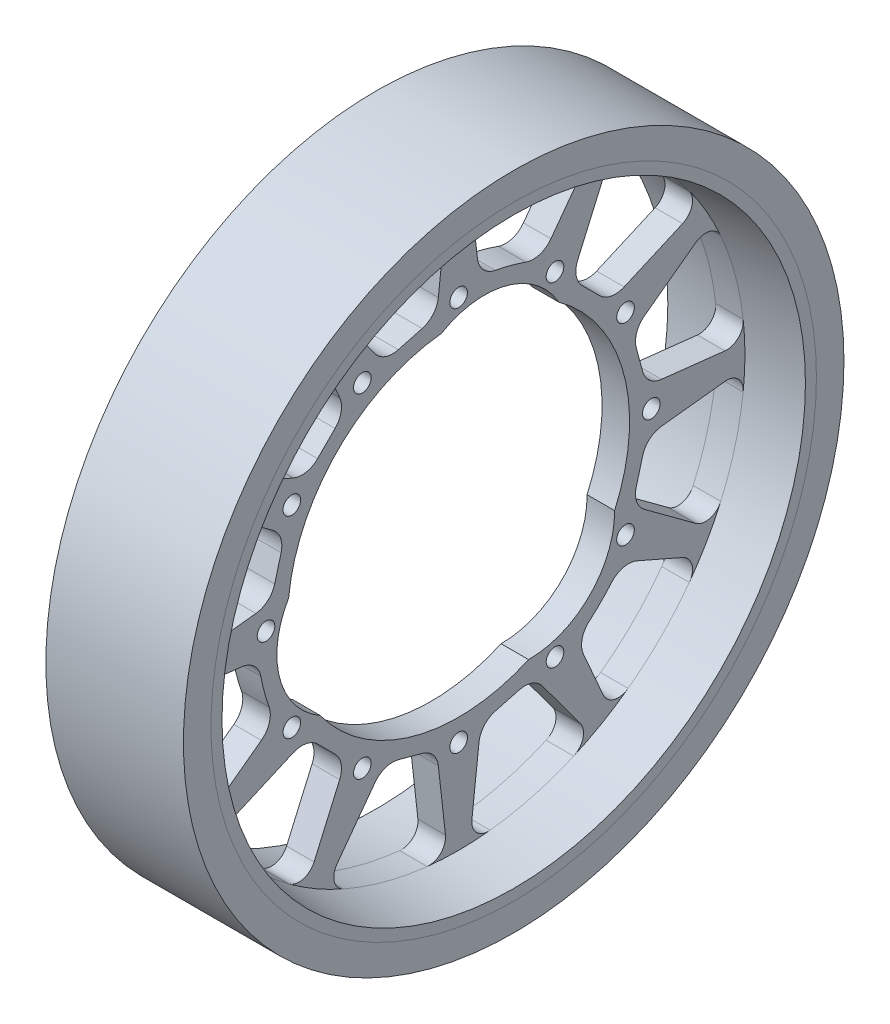
from build123d import *

# Parameters (mm, degrees)
SKETCH_2_R               = 1.6
CUT_EXTRUDE_1_DEPTH      = 80.214897589
SKETCH_3_W               = 25
SKETCH_3_H               = 5
CUT_EXTRUDE_2_DEPTH      = 87.168439698
PATTERN_CIRCULAR_1_COUNT = 12
SKETCH_5_R               = 15.5
CUT_EXTRUDE_3_DEPTH      = 10
EXTRUDE_1_DEPTH          = 5
PATTERN_CIRCULAR_6_COUNT = 3
FILLET_1_R               = 4


with BuildPart() as part:
    # 草图1 → 旋转1 (revolve)
    with BuildSketch(Plane.XY, mode=Mode.PRIVATE) as revolve_1_sk:
        Polygon((-12.5, 55), (-12.5, 53), (-2.5, 52), (-2.5, 31.05), (2.5, 31.05), (2.5, 52), (12.5, 53), (12.5, 55), align=None)
    revolve(revolve_1_sk.sketch.rotate(Axis((0, 0, 0), (-1, 0, 0)), 90), axis=Axis((0, 0, 0), (-1, 0, 0)))

    # 草图2 → 切除-拉伸1 (cut, through all)
    with BuildSketch(Plane(origin=(2.5, 0, 0), x_dir=(0, 0, -1), z_dir=(1, 0, 0))):
        with Locations((0, 35)):
            Circle(SKETCH_2_R)
        with Locations((17.5, 30.310889132)):
            Circle(SKETCH_2_R)
        with Locations((30.310889132, 17.5)):
            Circle(SKETCH_2_R)
        with Locations((35, 0)):
            Circle(SKETCH_2_R)
        with Locations((30.310889132, -17.5)):
            Circle(SKETCH_2_R)
        with Locations((17.5, -30.310889132)):
            Circle(SKETCH_2_R)
        with Locations((0, -35)):
            Circle(SKETCH_2_R)
        with Locations((-17.5, -30.310889132)):
            Circle(SKETCH_2_R)
        with Locations((-30.310889132, -17.5)):
            Circle(SKETCH_2_R)
        with Locations((-35, 0)):
            Circle(SKETCH_2_R)
        with Locations((-30.310889132, 17.5)):
            Circle(SKETCH_2_R)
        with Locations((-17.5, 30.310889132)):
            Circle(SKETCH_2_R)
    extrude(amount=-CUT_EXTRUDE_1_DEPTH, mode=Mode.SUBTRACT)

    # 草图4 → 切除-拉伸2 (cut, through all)
    with BuildSketch(Plane(origin=(2.5, 0, 0), x_dir=(0, 0, -1), z_dir=(1, 0, 0))):
        with BuildLine():
            Line((2.402892302, 48.3689475), (3.695896482, 36.839273923))
            ThreePointArc((3.695896482, 36.839273923), (4.638411997, 34.676702137), (6.635701751, 33.421359208))
            Line((6.635701751, 33.421359208), (10.963993316, 32.261596979))
            ThreePointArc((10.963993316, 32.261596979), (13.321368445, 32.350110969), (15.218896719, 33.751695315))
            Line((15.218896719, 33.751695315), (22.103507974, 43.09018344))
            ThreePointArc((22.103507974, 43.09018344), (22.587175644, 45.644561887), (20.89422353, 47.617553728))
            ThreePointArc((20.89422353, 47.617553728), (13.458590345, 50.228142967), (5.713848495, 51.68512296))
            ThreePointArc((5.713848495, 51.68512296), (3.261213036, 50.822937961), (2.402892302, 48.3689475))
        make_face()
    cut_extrude_2 = extrude(amount=-CUT_EXTRUDE_2_DEPTH, mode=Mode.SUBTRACT)

    # 阵列(圆周)1: 切除-拉伸2 ×12 about axis
    pattern_circular_1_axis = Axis((0, 0, 0), (1, 0, 0))
    for i in range(1, PATTERN_CIRCULAR_1_COUNT):
        add(cut_extrude_2.rotate(pattern_circular_1_axis, i * 360 / PATTERN_CIRCULAR_1_COUNT), mode=Mode.SUBTRACT)

    # 草图5 → 切除-拉伸3 (cut)
    with BuildSketch(Plane(origin=(2.5, 0, 0), x_dir=(0, 0, -1), z_dir=(1, 0, 0))):
        with Locations((4.697565669, 17.531553747)):
            Circle(SKETCH_5_R)
        with Locations((12.833988079, -12.833988079)):
            Circle(SKETCH_5_R)
        with Locations((-17.531553747, -4.697565669)):
            Circle(SKETCH_5_R)
    extrude(amount=-CUT_EXTRUDE_3_DEPTH, mode=Mode.SUBTRACT)

    # 草图6 → 凸台-拉伸1 (add)
    with BuildSketch(Plane(origin=(2.5, 0, 0), x_dir=(0, 0, -1), z_dir=(1, 0, 0))):
        with BuildLine():
            Line((6.635701751, 33.421359208), (10.963993316, 32.261596979))
            ThreePointArc((10.963993316, 32.261596979), (13.086337532, 32.275847975), (14.90263486, 33.373851654))
            ThreePointArc((14.90263486, 33.373851654), (9.459836098, 35.304588951), (3.780865455, 36.353920785))
            ThreePointArc((3.780865455, 36.353920785), (4.804823242, 34.494873041), (6.635701751, 33.421359208))
        make_face()
    extrude_1 = extrude(amount=-EXTRUDE_1_DEPTH)

    # 阵列(圆周)6: 凸台-拉伸1 ×3 about axis
    pattern_circular_6_axis = Axis((0, 0, 0), (1, 0, 0))
    for i in range(1, PATTERN_CIRCULAR_6_COUNT):
        add(extrude_1.rotate(pattern_circular_6_axis, i * 360 / PATTERN_CIRCULAR_6_COUNT))

    # 圆角1
    fillet_1_edges = [part.edges().sort_by_distance(p)[0] for p in [
        (0, 33.373851654, -14.90263486),
        (0, 36.353920785, -3.780865455),
        (0, -29.592986199, -21.451285925),
        (0, -21.451285925, -29.592986199),
        (0, -14.90263486, 33.373851654),
        (0, -3.780865455, 36.353920785),
    ]]
    fillet(fillet_1_edges, radius=FILLET_1_R - 0.0001)  # a hair under: the kernel refuses the full size


with BuildPart() as body_2:
    # 草图3 → 旋转2 (revolve)
    with BuildSketch(Plane.XY, mode=Mode.PRIVATE) as revolve_2_sk:
        with Locations((0, 57.5)):
            Rectangle(SKETCH_3_W, SKETCH_3_H)
    revolve(revolve_2_sk.sketch.rotate(Axis((0, 0, 0), (-1, 0, 0)), 90), axis=Axis((0, 0, 0), (-1, 0, 0)))


solid = Compound([part.part, body_2.part])
